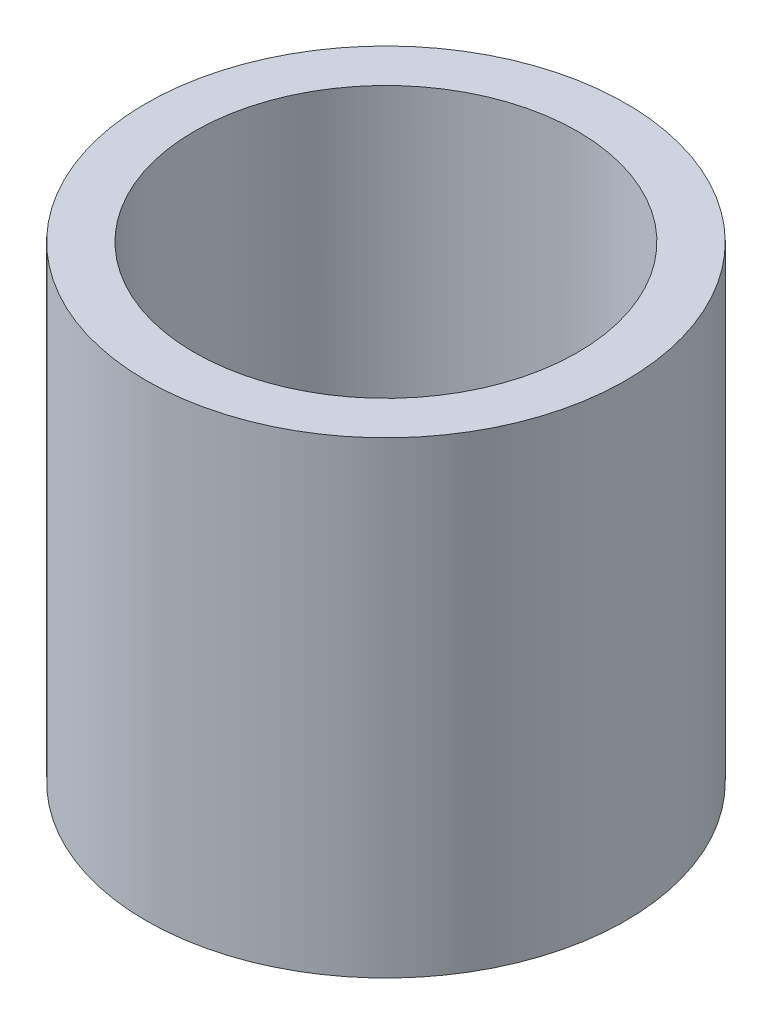
from build123d import *

# Parameters (mm, degrees)
BASISTEIL_SHELLV1_0_0_1_OUTLINE_R   = 20
BASISTEIL_SHELLV1_0_0_1_OUTLINE_R_2 = 15.972775
BASISTEIL_SHELLV1_0_0_1_DEPTH       = 39
SKIZZE2_R                           = 17.246382695
SKIZZE2_R_2                         = 15.972775
AUFSATZ_LINEAR_AUSTRAGEN1_DEPTH     = 10
AUFSATZ_LINEAR_AUSTRAGEN1_DRAFT     = -5


# Read off the part's stored shape, not the designer's step: Basisteil-ShellV1_0_0-1
with BuildPart() as part:
    # Basisteil-ShellV1_0_0-1 outline → Basisteil-ShellV1_0_0-1 (new body)
    with BuildSketch(Plane(origin=(0, 0, 0), x_dir=(1, 0, 0), z_dir=(0, 1, 0))):
        Circle(BASISTEIL_SHELLV1_0_0_1_OUTLINE_R)
        Circle(BASISTEIL_SHELLV1_0_0_1_OUTLINE_R_2, mode=Mode.SUBTRACT)
    extrude(amount=BASISTEIL_SHELLV1_0_0_1_DEPTH)


with BuildPart() as aufsatz_linear_austragen1_tool:
    # Skizze2 → Aufsatz-Linear austragen1 (with draft: the straight prism first)
    with BuildSketch(Plane(origin=(0, 10, 0), x_dir=(-1, 0, 0), z_dir=(0, -1, 0))):
        Circle(SKIZZE2_R)
        with Locations(Location((0, 0, 0), (0, 0, 104.742129046))):
            Circle(SKIZZE2_R_2, mode=Mode.SUBTRACT)
    extrude(amount=AUFSATZ_LINEAR_AUSTRAGEN1_DEPTH)
    # Aufsatz-Linear austragen1: the draft: its side faces are tilted about the plane it starts from
    aufsatz_linear_austragen1_sides = [aufsatz_linear_austragen1_tool.faces().sort_by_distance(p)[0] for p in [
        (17.246382695, 5, 0),
        (-4.064577659, 5, 15.44696571),
    ]]
    draft(aufsatz_linear_austragen1_sides, Plane(origin=(0, 10, 0), x_dir=(-1, 0, 0), z_dir=(0, -1, 0)), AUFSATZ_LINEAR_AUSTRAGEN1_DRAFT)


with BuildPart() as part_1:
    add(part.part)

    # Aufsatz-Linear austragen1: add aufsatz_linear_austragen1_tool
    add(aufsatz_linear_austragen1_tool.part)


solid = part_1.part
